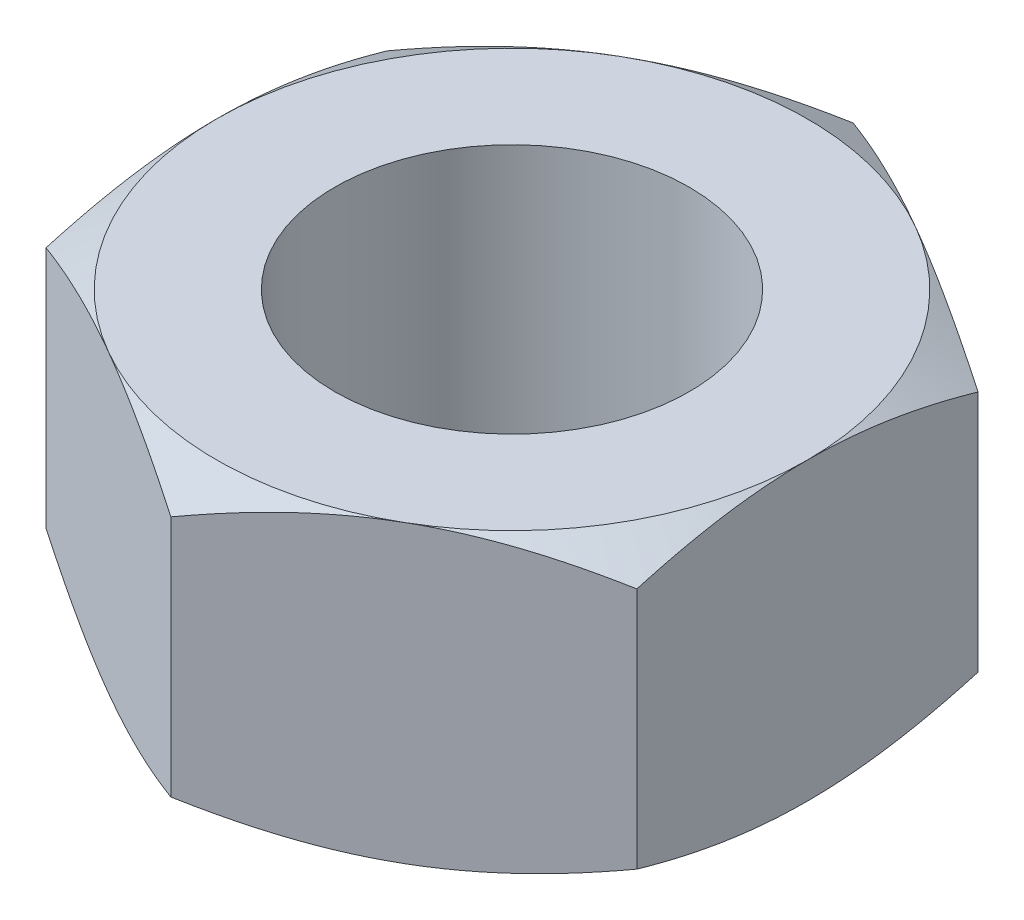
from build123d import *

# Parameters (mm, degrees)
SKETCH1_R               = 3
BOSS_EXTRUDE1_DEPTH     = 2.5
SKETCH5_OUTSIDE_W       = 50.302
SKETCH5_OUTSIDE_H       = 51.85
SKETCH5_OUTSIDE_R       = 5
CUT_EXTRUDE2_DEPTH      = 10.128709292
CUT_EXTRUDE2_DRAFT      = -60
MIRROR1_COPY_1_SKETCH_W = 50.302
MIRROR1_COPY_1_SKETCH_H = 51.85
MIRROR1_COPY_1_SKETCH_R = 5
MIRROR1_COPY_1_DEPTH    = 10.128709292
MIRROR1_COPY_1_DRAFT    = -60


with BuildPart() as part:
    # Sketch1 → Boss-Extrude1 (new, symmetric)
    with BuildSketch(Plane(origin=(0, 0, 0), x_dir=(1, 0, 0), z_dir=(0, 1, 0))):
        Polygon((-5, 2.886751346), (-5, -2.886751346), (0, -5.773502692), (5, -2.886751346), (5, 2.886751346), (0, 5.773502692), align=None)
        Circle(SKETCH1_R, mode=Mode.SUBTRACT)
    extrude(amount=BOSS_EXTRUDE1_DEPTH, both=True)


with BuildPart() as cut_extrude2_tool:
    # Sketch5 outside → Cut-Extrude2 (with draft: the straight prism first)
    with BuildSketch(Plane(origin=(0, 2.5, 0), x_dir=(1, 0, 0), z_dir=(0, 1, 0))):
        Rectangle(SKETCH5_OUTSIDE_W, SKETCH5_OUTSIDE_H)
        Circle(SKETCH5_OUTSIDE_R, mode=Mode.SUBTRACT)
    extrude(amount=-CUT_EXTRUDE2_DEPTH)
    # Cut-Extrude2: the draft: its side faces are tilted about the plane it starts from
    cut_extrude2_sides = [cut_extrude2_tool.faces().sort_by_distance(p)[0] for p in [
        (0, -2.564354646, 25.925),
        (25.151, -2.564354646, 0),
        (0, -2.564354646, -25.925),
        (-25.151, -2.564354646, 0),
        (-5, -2.564354646, 0),
    ]]
    draft(cut_extrude2_sides, Plane(origin=(0, 2.5, 0), x_dir=(1, 0, 0), z_dir=(0, 1, 0)), CUT_EXTRUDE2_DRAFT)


with BuildPart() as part_1:
    add(part.part)

    # Cut-Extrude2: cut by cut_extrude2_tool
    add(cut_extrude2_tool.part, mode=Mode.SUBTRACT)


with BuildPart() as mirror1_copy_1_tool:
    # Mirror1 copy 1 sketch → Mirror1 copy 1 (with draft: the straight prism first)
    with BuildSketch(Plane.XZ.offset(2.5)):
        Rectangle(MIRROR1_COPY_1_SKETCH_W, MIRROR1_COPY_1_SKETCH_H)
        Circle(MIRROR1_COPY_1_SKETCH_R, mode=Mode.SUBTRACT)
    extrude(amount=-MIRROR1_COPY_1_DEPTH)
    # Mirror1 copy 1: the draft: its side faces are tilted about the plane it starts from
    mirror1_copy_1_sides = [mirror1_copy_1_tool.faces().sort_by_distance(p)[0] for p in [
        (0, 2.564354646, 25.925),
        (25.151, 2.564354646, 0),
        (0, 2.564354646, -25.925),
        (-25.151, 2.564354646, 0),
        (-5, 2.564354646, 0),
    ]]
    draft(mirror1_copy_1_sides, Plane.XZ.offset(2.5), MIRROR1_COPY_1_DRAFT)


with BuildPart() as part_2:
    add(part_1.part)

    # Mirror1 copy 1: cut by mirror1_copy_1_tool
    add(mirror1_copy_1_tool.part, mode=Mode.SUBTRACT)


solid = part_2.part
